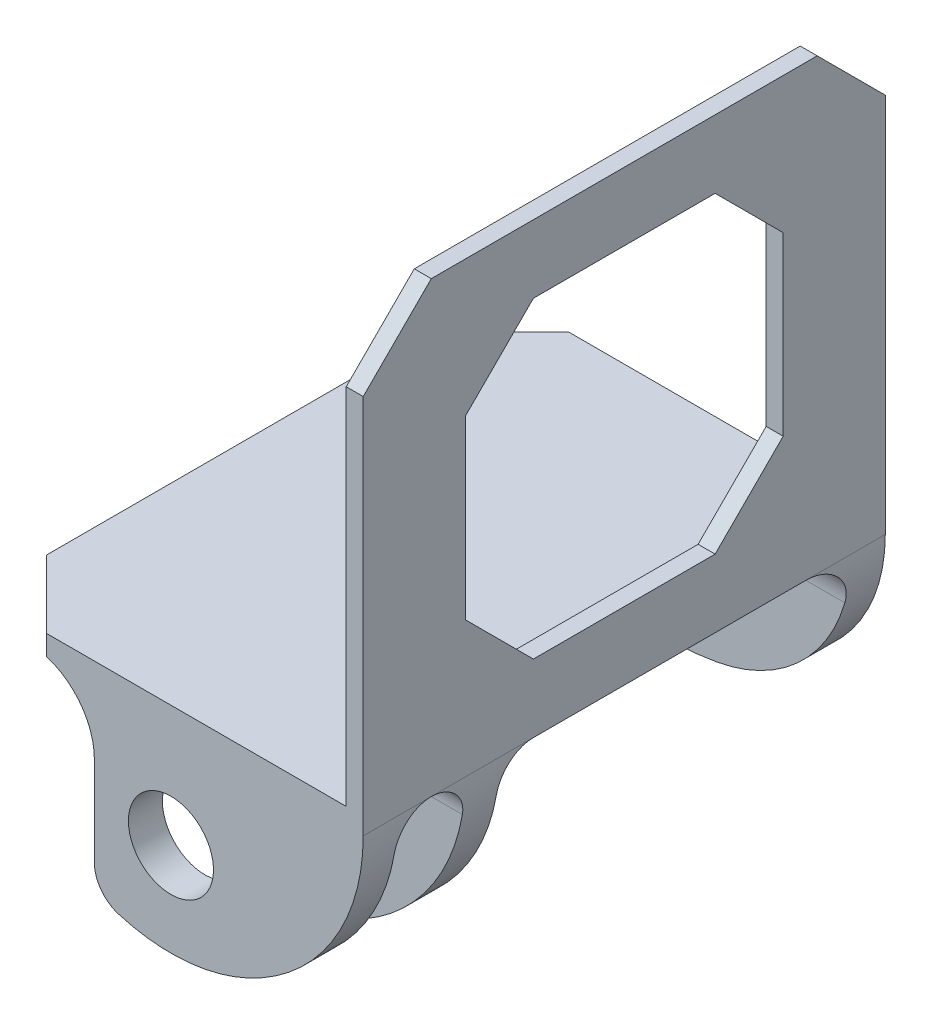
from build123d import *

# Parameters (mm, degrees)
SKETCH1_W            = 71.755
SKETCH1_H            = 97.409
BOSS_EXTRUDE1_DEPTH  = 3.175
SKETCH3_W            = 3.175
SKETCH3_H            = 97.409
BOSS_EXTRUDE4_DEPTH  = 80.518
BOSS_EXTRUDE10_START = -48.7045
SKETCH8_R            = 3.175
BOSS_EXTRUDE10_DEPTH = 6.35
CUT_EXTRUDE1_REACH   = 149.112
SKETCH9_W            = 59.309
SKETCH9_H            = 58.293
FILLET3_SIZE         = 12.7
CHAMFER1_SIZE        = 12.7
BOSS_EXTRUDE11_DEPTH = 6.35
LPATTERN1_COUNT      = 2
LPATTERN1_PITCH      = 19.05
FILLET2_START        = 25.0825
FILLET2_DEPTH        = 42.13313265
FILLET2_START_2      = 67.21563265
FILLET2_2_DEPTH      = 4.53936745
FILLET2_START_3      = -91.059
FILLET2_3_DEPTH      = 9.059
FILLET4_R            = 6.35
FILLET5_R            = 12.7


with BuildPart() as part:
    # Sketch1 → Boss-Extrude1 (new body)
    with BuildSketch(Plane(origin=(0, 0, 0), x_dir=(1, 0, 0), z_dir=(0, 1, 0))):
        with Locations((35.8775, 48.7045)):
            Rectangle(SKETCH1_W, SKETCH1_H)
    extrude(amount=BOSS_EXTRUDE1_DEPTH)

    # Sketch3 → Boss-Extrude4 (add)
    with BuildSketch(Plane(origin=(0, 3.175, 0), x_dir=(1, 0, 0), z_dir=(0, 1, 0))):
        with Locations((70.1675, 48.7045)):
            Rectangle(SKETCH3_W, SKETCH3_H)
    extrude(amount=BOSS_EXTRUDE4_DEPTH)

    # Sketch8 → Boss-Extrude10 (add)
    with BuildSketch(Plane.XY.offset(-48.7045).offset(BOSS_EXTRUDE10_START)):
        with BuildLine():
            Line((25.0825, 0), (25.0825, -29.972))
            ThreePointArc((25.0825, -29.972), (35.8775, -30.93072549), (46.6725, -29.972))
            ThreePointArc((46.6725, -29.972), (64.657067872, -19.541318982), (71.755, 0))
            Line((71.755, 0), (46.6725, 0))
            Line((46.6725, 0), (25.0825, 0))
        make_face()
        with Locations((35.8775, -19.472)):
            Circle(SKETCH8_R, mode=Mode.SUBTRACT)
    extrude(amount=BOSS_EXTRUDE10_DEPTH)

    # Sketch9 → Cut-Extrude1 (cut, up to next)
    with BuildSketch(Plane(origin=(71.755, 0, 0), x_dir=(0, 0, -1), z_dir=(1, 0, 0)), mode=Mode.PRIVATE) as cut_extrude1_sk1:
        with Locations((48.7045, 41.8465)):
            Rectangle(SKETCH9_W, SKETCH9_H)
    cut_extrude1_tool1 = extrude(cut_extrude1_sk1.sketch, amount=-CUT_EXTRUDE1_REACH, mode=Mode.PRIVATE) & part.part
    add(cut_extrude1_tool1.solids().sort_by_distance((71.755, 41.8465, -48.7045))[0], mode=Mode.SUBTRACT)

    # Fillet3
    fillet3_edges = [part.edges().sort_by_distance(p)[0] for p in [
        (70.1675, 83.693, -97.409),
        (70.1675, 83.693, 0),
        (0, 1.5875, -97.409),
        (0, 1.5875, 0),
    ]]
    chamfer(fillet3_edges, length=FILLET3_SIZE)

    # Chamfer1
    chamfer1_edges = [part.edges().sort_by_distance(p)[0] for p in [
        (70.1675, 70.993, -19.05),
        (70.1675, 70.993, -78.359),
        (70.1675, 12.7, -78.359),
        (70.1675, 12.7, -19.05),
    ]]
    chamfer(chamfer1_edges, length=CHAMFER1_SIZE)

    # Sketch10 → Boss-Extrude11 (add)
    # profile 1 of 3: a face of its own
    with BuildSketch(Plane.XY):
        Polygon((50.165, 0), (35.8775, 0), (21.59, 0), (21.59, -33.7595), (50.165, -33.7595), align=None)
        with BuildLine():
            ThreePointArc((43.815, -19.472), (30.264839924, -25.084660076), (35.8775, -11.5345))
            ThreePointArc((35.8775, -11.5345), (41.490160076, -13.859339924), (43.815, -19.472))
        make_face(mode=Mode.SUBTRACT)
    # profile 2 of 3: a face of its own
    with BuildSketch(Plane.XY):
        with BuildLine():
            Line((71.755, 0), (50.165, 0))
            Line((50.165, 0), (50.165, -33.7595))
            ThreePointArc((50.165, -33.7595), (65.895964881, -20.036416473), (71.755, 0))
        make_face()
    # profile 3 of 3: a face of its own
    with BuildSketch(Plane.XY):
        with BuildLine():
            Line((50.165, -33.7595), (21.59, -33.7595))
            ThreePointArc((21.59, -33.7595), (35.8775, -36.900842401), (50.165, -33.7595))
        make_face()
    boss_extrude11 = extrude(amount=-BOSS_EXTRUDE11_DEPTH)

    # LPattern1: Boss-Extrude11 ×2
    with Locations(*[(0, 0, -i * LPATTERN1_PITCH) for i in range(1, LPATTERN1_COUNT)]):
        add(boss_extrude11)

    # Fillet2: read off the stored shape, not the designer's step
    # Fillet2 outline → Fillet2 (add)
    with BuildSketch(Plane.YZ.offset(FILLET2_START)):
        with BuildLine():
            Line((0, -91.059), (0, -82.592333333))
            ThreePointArc((0, -82.592333333), (-2.479829253, -88.579170747), (-8.466666667, -91.059))
            Line((-8.466666667, -91.059), (0, -91.059))
        make_face()
    extrude(amount=FILLET2_DEPTH)

    # Fillet2 2 outline → Fillet2 2 (add)
    with BuildSketch(Plane.YZ.offset(FILLET2_START_2)):
        with BuildLine():
            Line((0, -91.059), (0, -82.592333333))
            ThreePointArc((0, -82.592333333), (-2.479829253, -88.579170747), (-8.466666667, -91.059))
            Line((-8.466666667, -91.059), (0, -91.059))
        make_face()
    extrude(amount=FILLET2_2_DEPTH)

    # Fillet2 3 outline → Fillet2 3 (cut)
    with BuildSketch(Plane.XY.offset(FILLET2_START_3)):
        with BuildLine():
            ThreePointArc((71.755, 0), (71.453300711, -4.275699044), (70.55418161, -8.466666667))
            Line((70.55418161, -8.466666667), (71.7550001, -8.466666667))
            Line((71.7550001, -8.466666667), (71.755, 0))
        make_face()
    extrude(amount=FILLET2_3_DEPTH, mode=Mode.SUBTRACT)

    # Fillet4
    fillet4_edges = [part.edges().sort_by_distance(p)[0] for p in [
        (46.6725, 0, -6.35),
        (21.59, -33.7595, -3.175),
        (46.6725, 0, -25.4),
        (21.59, -33.7595, -22.225),
        (46.6725, 0, -19.05),
        (25.0825, -29.972, -94.234),
    ]]
    fillet(fillet4_edges, radius=FILLET4_R - 0.0001)  # a hair under: the kernel refuses the full size

    # Fillet5
    fillet5_edges = [part.edges().sort_by_distance(p)[0] for p in [
        (21.59, 0, -6.34995),
        (21.59, 0, -22.225),
        (25.0825, 0, -90.000666666),
    ]]
    fillet(fillet5_edges, radius=FILLET5_R)


solid = part.part
